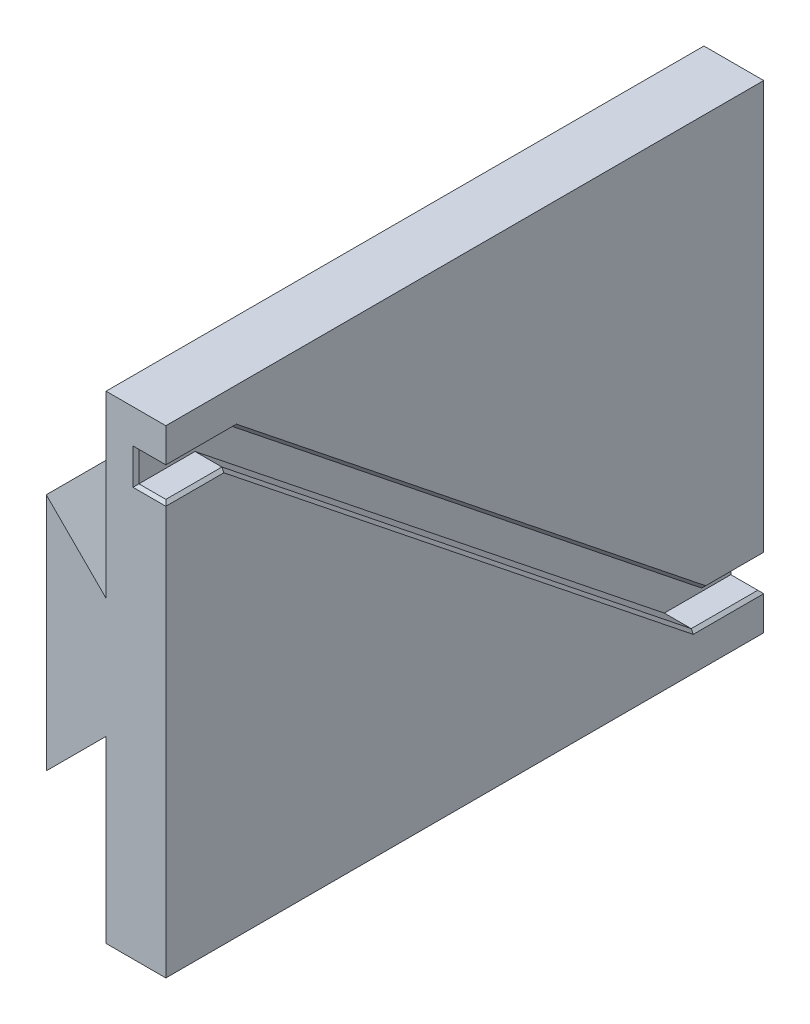
from build123d import *

# Parameters (mm, degrees)
BOSS_EXTRUDE1_DEPTH = 100
CUT_EXTRUDE1_DEPTH  = 10
CHAMFER1_SIZE       = 1


with BuildPart() as part:
    # Sketch1 → Boss-Extrude1 (new, symmetric)
    with BuildSketch(Plane.XY):
        Polygon((0, 80), (-20, 80), (-20, 20), (-40, 40), (-40, -40), (-20, -20), (-20, -80), (0, -80), align=None)
    extrude(amount=BOSS_EXTRUDE1_DEPTH, both=True)

    # Sketch2 → Cut-Extrude1 (cut)
    with BuildSketch(Plane(origin=(0, 0, 0), x_dir=(0, 0, -1), z_dir=(1, 0, 0))):
        Polygon((-100, 57.660237389), (-80.250855225, 57.660237389), (76.749144775, -67.660237389), (100, -67.660237389), (100, -57.660237389), (80.250855225, -57.660237389), (-76.749144775, 67.660237389), (-100, 67.660237389), align=None)
    extrude(amount=-CUT_EXTRUDE1_DEPTH, mode=Mode.SUBTRACT)

    # Chamfer1
    chamfer1_edges = [part.edges().sort_by_distance(p)[0] for p in [
        (-5, -67.660237389, -100),
        (-10, -62.660237389, -100),
        (-5, -57.660237389, -100),
        (0, -67.660237389, -88.374572387),
        (0, -57.660237389, -90.125427613),
        (0, -5, 1.750855225),
        (0, 57.660237389, 90.125427613),
        (-5, 57.660237389, 100),
        (-10, 62.660237389, 100),
        (-5, 67.660237389, 100),
        (0, 67.660237389, 88.374572387),
        (0, 5, -1.750855225),
    ]]
    chamfer(chamfer1_edges, length=CHAMFER1_SIZE)


solid = part.part
